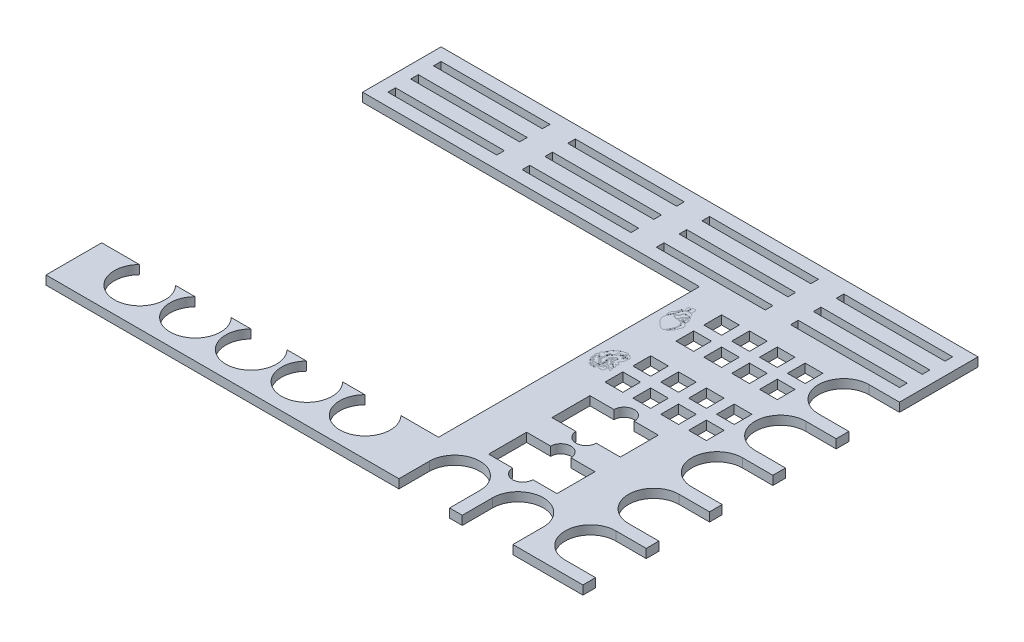
from build123d import *

# Parameters (mm, degrees)
SKETCH_1_W          = 43
SKETCH_1_H          = 3
SKETCH_1_W_2        = 7
SKETCH_1_H_2        = 7
EXTRUDE_1_DEPTH     = 3.5
CUT_EXTRUDE_START   = -0.01
CUT_EXTRUDE_1_DEPTH = 0.01


# Read off the part's stored shape, not the designer's step: Вырез-Вытянуть1
with BuildPart() as part:
    # Эскиз1 → Бобышка-Вытянуть1 (new body)
    with BuildSketch(Plane(origin=(0, 0, 0), x_dir=(1, 0, 0), z_dir=(0, 1, 0))):
        with BuildLine():
            Line((-106, 78), (106, 78))
            Line((106, 78), (106, 47))
            Line((106, 47), (94, 47))
            ThreePointArc((94, 47), (84, 37), (94, 27))
            Line((94, 27), (106, 27))
            Line((106, 27), (106, 22))
            Line((106, 22), (94, 22))
            ThreePointArc((94, 22), (84, 12), (94, 2))
            Line((94, 2), (106, 2))
            Line((106, 2), (106, -3))
            Line((106, -3), (94, -3))
            ThreePointArc((94, -3), (84, -13), (94, -23))
            Line((94, -23), (106, -23))
            Line((106, -23), (106, -28))
            Line((106, -28), (94, -28))
            ThreePointArc((94, -28), (84, -38), (94, -48))
            Line((94, -48), (106, -48))
            Line((106, -48), (106, -53))
            Line((106, -53), (94, -53))
            ThreePointArc((94, -53), (84, -63), (94, -73))
            Line((94, -73), (106, -73))
            Line((106, -73), (106, -78))
            Line((106, -78), (78.35327994, -78))
            Line((78.35327994, -78), (78.35327994, -66))
            ThreePointArc((78.35327994, -66), (68.35327994, -56), (58.35327994, -66))
            Line((58.35327994, -66), (58.35327994, -78))
            Line((58.35327994, -78), (53.35327994, -78))
            Line((53.35327994, -78), (53.35327994, -66))
            ThreePointArc((53.35327994, -66), (43.35327994, -56), (33.35327994, -66))
            Line((33.35327994, -66), (33.35327994, -78))
            Line((33.35327994, -78), (-106, -78))
            Line((-106, -78), (-106, -56))
            Line((-106, -56), (-91.141428429, -56))
            ThreePointArc((-91.141428429, -56), (-84, -73), (-76.858571571, -56))
            Line((-76.858571571, -56), (-69.141428429, -56))
            ThreePointArc((-69.141428429, -56), (-62, -73), (-54.858571571, -56))
            Line((-54.858571571, -56), (-47.141428429, -56))
            ThreePointArc((-47.141428429, -56), (-40, -73), (-32.858571571, -56))
            Line((-32.858571571, -56), (-25.141428429, -56))
            ThreePointArc((-25.141428429, -56), (-18, -73), (-10.858571571, -56))
            Line((-10.858571571, -56), (-2.141428429, -56))
            ThreePointArc((-2.141428429, -56), (5, -73), (12.141428429, -56))
            Line((12.141428429, -56), (27, -56))
            Line((27, -56), (27, 47))
            Line((27, 47), (-106, 47))
            Line((-106, 47), (-106, 78))
        make_face()
        with Locations((-26.5, 71.5)):
            Rectangle(SKETCH_1_W, SKETCH_1_H, mode=Mode.SUBTRACT)
        with Locations((-79.5, 71.5)):
            Rectangle(SKETCH_1_W, SKETCH_1_H, mode=Mode.SUBTRACT)
        with Locations((26.5, 71.5)):
            Rectangle(SKETCH_1_W, SKETCH_1_H, mode=Mode.SUBTRACT)
        with Locations((79.5, 71.5)):
            Rectangle(SKETCH_1_W, SKETCH_1_H, mode=Mode.SUBTRACT)
        with Locations((-26.5, 62.5)):
            Rectangle(SKETCH_1_W, SKETCH_1_H, mode=Mode.SUBTRACT)
        with Locations((26.5, 62.5)):
            Rectangle(SKETCH_1_W, SKETCH_1_H, mode=Mode.SUBTRACT)
        with Locations((79.5, 62.5)):
            Rectangle(SKETCH_1_W, SKETCH_1_H, mode=Mode.SUBTRACT)
        with Locations((-26.5, 53.5)):
            Rectangle(SKETCH_1_W, SKETCH_1_H, mode=Mode.SUBTRACT)
        with Locations((26.5, 53.5)):
            Rectangle(SKETCH_1_W, SKETCH_1_H, mode=Mode.SUBTRACT)
        with Locations((79.5, 53.5)):
            Rectangle(SKETCH_1_W, SKETCH_1_H, mode=Mode.SUBTRACT)
        with Locations((-79.5, 62.5)):
            Rectangle(SKETCH_1_W, SKETCH_1_H, mode=Mode.SUBTRACT)
        with Locations((-79.5, 53.5)):
            Rectangle(SKETCH_1_W, SKETCH_1_H, mode=Mode.SUBTRACT)
        with BuildLine():
            Line((60.157282311, -26.891683443), (69.657282311, -26.891683443))
            Line((69.657282311, -26.891683443), (69.657282311, -11.891683443))
            Line((69.657282311, -11.891683443), (60.157282311, -11.891683443))
            ThreePointArc((60.157282311, -11.891683443), (56.157282311, -7.891683443), (52.157282311, -11.891683443))
            Line((52.157282311, -11.891683443), (42.657282311, -11.891683443))
            Line((42.657282311, -11.891683443), (42.657282311, -26.891683443))
            Line((42.657282311, -26.891683443), (52.157282311, -26.891683443))
            ThreePointArc((52.157282311, -26.891683443), (56.157282311, -30.891683443), (60.157282311, -26.891683443))
        make_face(mode=Mode.SUBTRACT)
        with Locations((55.508285054, -0.759055808)):
            Rectangle(SKETCH_1_W_2, SKETCH_1_H_2, mode=Mode.SUBTRACT)
        with Locations((44.508285054, -0.759055808)):
            Rectangle(SKETCH_1_W_2, SKETCH_1_H_2, mode=Mode.SUBTRACT)
        with Locations((66.508285054, -0.759055808)):
            Rectangle(SKETCH_1_W_2, SKETCH_1_H_2, mode=Mode.SUBTRACT)
        with Locations((77.508285054, -0.759055808)):
            Rectangle(SKETCH_1_W_2, SKETCH_1_H_2, mode=Mode.SUBTRACT)
        with Locations((55.508285054, 10.240944192)):
            Rectangle(SKETCH_1_W_2, SKETCH_1_H_2, mode=Mode.SUBTRACT)
        with Locations((66.508285054, 10.240944192)):
            Rectangle(SKETCH_1_W_2, SKETCH_1_H_2, mode=Mode.SUBTRACT)
        with Locations((77.508285054, 10.240944192)):
            Rectangle(SKETCH_1_W_2, SKETCH_1_H_2, mode=Mode.SUBTRACT)
        with Locations((44.508285054, 10.240944192)):
            Rectangle(SKETCH_1_W_2, SKETCH_1_H_2, mode=Mode.SUBTRACT)
        with Locations((55.508285054, 27.240944192)):
            Rectangle(SKETCH_1_W_2, SKETCH_1_H_2, mode=Mode.SUBTRACT)
        with Locations((44.508285054, 27.240944192)):
            Rectangle(SKETCH_1_W_2, SKETCH_1_H_2, mode=Mode.SUBTRACT)
        with Locations((66.508285054, 27.240944192)):
            Rectangle(SKETCH_1_W_2, SKETCH_1_H_2, mode=Mode.SUBTRACT)
        with Locations((77.508285054, 27.240944192)):
            Rectangle(SKETCH_1_W_2, SKETCH_1_H_2, mode=Mode.SUBTRACT)
        with Locations((55.508285054, 38.240944192)):
            Rectangle(SKETCH_1_W_2, SKETCH_1_H_2, mode=Mode.SUBTRACT)
        with Locations((66.508285054, 38.240944192)):
            Rectangle(SKETCH_1_W_2, SKETCH_1_H_2, mode=Mode.SUBTRACT)
        with Locations((77.508285054, 38.240944192)):
            Rectangle(SKETCH_1_W_2, SKETCH_1_H_2, mode=Mode.SUBTRACT)
        with Locations((44.508285054, 38.240944192)):
            Rectangle(SKETCH_1_W_2, SKETCH_1_H_2, mode=Mode.SUBTRACT)
        with BuildLine():
            Line((60.157282311, -36.891683443), (69.657282311, -36.891683443))
            Line((69.657282311, -36.891683443), (69.657282311, -51.891683443))
            Line((69.657282311, -51.891683443), (60.157282311, -51.891683443))
            ThreePointArc((60.157282311, -51.891683443), (56.157282311, -55.891683443), (52.157282311, -51.891683443))
            Line((52.157282311, -51.891683443), (42.657282311, -51.891683443))
            Line((42.657282311, -51.891683443), (42.657282311, -36.891683443))
            Line((42.657282311, -36.891683443), (52.157282311, -36.891683443))
            ThreePointArc((52.157282311, -36.891683443), (56.157282311, -32.891683443), (60.157282311, -36.891683443))
        make_face(mode=Mode.SUBTRACT)
    extrude(amount=EXTRUDE_1_DEPTH)

    # Вырез-Вытянуть1 outline → Вырез-Вытянуть1 (cut)
    # profile 1 of 13: a face of its own
    with BuildSketch(Plane(origin=(0, 3.5, 0), x_dir=(1, 0, 0), z_dir=(0, 1, 0)).offset(CUT_EXTRUDE_START)):
        with BuildLine():
            add(Edge.make_bspline(
                [(37.832977201, 7.763436347), (37.914677943, 7.790986776), (37.901483831, 8.111154719), (37.979396005, 8.508934145), (37.745558638, 9.13651473), (37.172045165, 9.307799235), (36.914597154, 9.733838633), (36.454197836, 9.679216158), (36.38826052, 9.341730406), (36.266408211, 9.010402911), (36.566985616, 8.723711458), (36.470469, 8.34551423), (36.527236167, 7.951877991), (36.630416047, 7.676367478), (36.778652109, 7.393084703), (36.559656053, 7.331700916), (36.562836217, 7.51640169), (36.440727503, 7.639106553), (36.368027046, 7.861204922), (36.316991655, 8.125996091), (36.34010323, 8.475159808), (36.092331473, 8.811822858), (36.179691192, 9.227273069), (36.346051143, 9.581912444), (36.146529664, 9.821147035), (36.06241639, 10.127532137), (35.799692668, 10.019475797), (35.597408908, 10.099824068), (35.378820413, 9.990675661), (35.115064373, 9.966319968), (34.780382888, 9.941667453), (34.721012614, 9.521621938), (34.512438116, 9.684377566), (34.303007581, 9.791691711), (33.920850418, 9.749232874), (33.727340978, 9.436003806), (33.419232695, 9.257101273), (33.133138351, 9.105006569), (32.85126227, 9.025428053), (32.663565542, 8.875022744), (32.58608671, 8.619168376), (32.236423069, 8.590790349), (32.189352641, 8.309418297), (32.258155071, 8.003665917), (32.010591461, 8.10269937), (31.71588142, 8.014140252), (31.350270508, 7.725746948), (31.165184976, 7.229355433), (31.028807324, 6.966438466), (30.896720796, 6.599754894), (31.239129036, 6.71890562), (30.987903693, 6.388990282), (30.733910335, 6.4086924), (30.452477202, 6.077545214), (30.701936354, 5.836280429), (30.922243162, 5.85181202), (31.19492474, 5.685911997), (31.013469403, 5.515170267), (30.773173692, 5.462504607), (30.573313112, 5.670584735), (30.227593929, 5.718171132), (30.059519961, 5.347778115), (29.821467836, 5.090829313), (29.78541654, 4.738088915), (29.952717197, 4.492419252), (30.236644459, 4.416827534), (30.514473811, 4.284981509), (30.480464167, 3.96359377), (30.201281477, 4.029665399), (29.976447925, 4.130398166), (29.896212011, 4.434697829), (29.549986668, 4.328033512), (29.728240538, 4.05323911), (29.700561549, 3.751673921), (29.37583707, 3.630259512), (29.463653577, 3.361008299), (29.500587531, 3.091370689), (29.785568656, 3.155422712), (30.024144702, 3.233301074), (30.544016001, 3.180994742), (30.39271647, 2.855502384), (30.207148484, 3.118723249), (29.944029199, 3.073342607), (29.830009183, 2.914720413), (29.545518487, 2.805152738), (29.722151692, 2.656794481), (29.879784352, 2.816262734), (30.105429595, 2.777554357), (30.289116469, 2.684832798), (30.318400511, 2.381962758), (30.027179694, 2.594305604), (29.726233656, 2.485985992), (29.594091122, 2.197660783), (29.64031772, 1.808133771), (29.984974936, 1.927639157), (30.179945243, 1.969089542), (30.468235845, 2.004927187), (30.313493691, 2.291581888), (30.790979129, 2.259495131), (30.527637775, 2.020126024), (30.530368948, 1.807892679), (30.481338651, 1.557170441), (30.147652148, 1.455233382), (30.021179843, 1.728770804), (29.666779455, 1.659525271), (29.883977071, 1.359512284), (29.963560753, 1.113822), (30.092077, 0.862822596), (30.358436146, 0.767158475), (30.412145466, 1.054166616), (30.659158552, 1.174146925), (30.851482573, 1.378423875), (31.11742166, 1.539498902), (31.32908855, 1.339117802), (31.375589607, 1.108312552), (31.224822954, 0.951454439), (31.031640089, 0.894428065), (30.852595493, 0.944058676), (30.658603378, 0.977785669), (30.563725157, 0.698540566), (30.916563539, 0.769767865), (31.141512569, 0.586311242), (31.470010625, 0.648682568), (31.778911861, 0.5835134), (32.11984532, 0.686077531), (32.292368847, 0.817025346), (32.576115173, 0.913310702), (32.461765325, 0.686502779), (32.315741681, 0.567876334), (32.057844814, 0.321746902), (31.736146641, 0.492923975), (31.407989757, 0.446944053), (31.03108698, 0.327740981), (30.694321442, 0.738415348), (30.523945613, 0.47566347), (30.311012375, 0.400861753), (30.351570064, 0.098571572), (30.562827883, 0.007674876), (30.678761185, 0.086958306), (30.807104212, 0.285022359), (30.958414115, -0.107315409), (31.348829244, -0.017130902), (31.377842931, -0.378429405), (31.629652399, -0.685809733), (31.805549956, -0.323413876), (32.048661791, -0.664195718), (32.365239481, -0.747778088), (32.22895774, -1.130032528), (32.012536157, -0.842226182), (31.773376346, -0.708222863), (31.541387816, -1.011030549), (31.384973333, -0.695613483), (31.181652041, -0.741539145), (31.296446857, -0.969660348), (31.537419155, -0.95092917), (31.821969734, -1.043780517), (32.074363663, -1.185310568), (32.397311627, -1.40006263), (32.822220786, -1.258011547), (33.192303588, -0.954582395), (33.19735465, -0.408578221), (32.965962867, -0.049098829), (32.985843317, 0.325595297), (33.161247705, 0.564282624), (33.105307476, 0.915849981), (32.93376646, 1.215291377), (32.666379992, 1.264516877), (32.601406029, 1.488832029), (32.843064887, 1.596714046), (33.033646254, 1.242304964), (33.351010556, 1.444382781), (33.755015001, 1.446899685), (33.586102243, 1.825635966), (33.284416072, 1.778768145), (33.022486127, 1.724603879), (32.846803536, 1.878512361), (32.685587683, 2.063835784), (32.463820309, 1.982925336), (32.279215402, 1.774131097), (32.2301873, 2.022990615), (32.055013734, 2.093110558), (31.934422329, 1.953986301), (31.754818192, 2.061447165), (31.786954412, 2.237593276), (31.823422872, 2.428168257), (31.665766387, 2.593058585), (31.847590702, 2.808032658), (31.495463607, 2.841393232), (31.338020041, 2.722387226), (31.119083963, 2.688977049), (30.901053554, 2.747031023), (30.98588444, 3.224205537), (31.206396673, 2.833541234), (31.3004401, 3.119826741), (31.551448417, 3.145890622), (31.765904607, 3.00126118), (32.047771816, 2.9573704), (32.285066972, 3.142883804), (32.136267699, 3.404655056), (31.821049295, 3.326855546), (31.50149075, 3.484205161), (31.144771152, 3.355443095), (30.82384602, 3.511560685), (30.552796428, 3.433476894), (30.298544939, 3.630864106), (30.51258912, 3.825719984), (30.729532447, 3.645037797), (31.006179678, 3.702852958), (31.301625498, 3.622850543), (31.677820231, 3.71449344), (31.877109422, 4.068972948), (31.984111872, 4.425633766), (31.925674691, 4.746688574), (31.731169446, 5.07988369), (31.984264698, 5.382106302), (32.09147655, 5.68982143), (32.330040986, 5.821117079), (32.321942437, 6.171330178), (32.011942368, 6.087511343), (31.901407761, 6.322412004), (32.109231267, 6.568580806), (32.465735416, 6.634103308), (32.796747282, 6.414075547), (33.043243552, 6.618710675), (33.254344755, 6.766186992), (33.382417747, 6.992223866), (33.545234042, 7.212099726), (33.605081388, 7.532276018), (33.521127843, 7.869561278), (33.606623961, 8.217454429), (33.823282202, 8.494444748), (34.207705387, 8.557707204), (34.334242115, 8.34631462), (34.470170039, 8.184798733), (34.636658131, 8.373778116), (34.767255473, 8.54685575), (34.956645745, 8.740436556), (35.205411842, 8.729273224), (35.324909722, 8.639308814), (35.518775071, 8.56874904), (35.522975909, 8.760132659), (35.62583628, 8.884760752), (35.641635484, 9.107200734), (35.68632012, 9.293374951), (35.846923705, 9.556468753), (35.998565853, 9.352417895), (35.938789984, 9.188806293), (35.832693438, 9.015919367), (35.816095691, 8.81475707), (35.806700768, 8.556509763), (36.108028316, 8.370406405), (36.093360052, 8.022168813), (36.239669655, 7.684206105), (36.38253244, 7.338570422), (36.46392818, 7.035361901), (36.466339155, 6.781088577), (36.28314099, 6.762710575), (36.259957775, 6.943411675), (36.214412679, 7.121010557), (36.086196222, 7.323426736), (36.028933296, 7.583981918), (35.899086394, 7.820519003), (35.807700642, 8.053627715), (35.761185224, 8.238925934), (35.605063392, 8.402911749), (35.47032165, 8.216403513), (35.309695074, 8.049165757), (35.239233059, 7.800681964), (35.072502957, 7.557270186), (34.851711351, 7.633359881), (34.971430204, 7.811930666), (35.080412872, 7.923373001), (34.979895307, 8.103835649), (34.821715116, 7.887440589), (34.776943046, 7.722515684), (34.566001243, 7.562825717), (34.350695228, 7.67035676), (34.107892154, 7.636194837), (34.05859968, 7.43717264), (34.221389216, 7.32793201), (34.058824129, 7.039884855), (33.710665479, 6.992549804), (33.484199873, 6.67656291), (33.315539443, 6.378631018), (33.091150137, 6.148406432), (32.819978079, 6.151202069), (32.602560234, 6.144826552), (32.557640672, 5.92470001), (32.682642656, 5.791304427), (32.553413834, 5.607781658), (32.390476633, 5.473290872), (32.222545266, 5.312937585), (32.055267329, 5.144020167), (32.167598484, 4.963707501), (32.367185856, 5.008192252), (32.545024025, 5.143037609), (32.718477857, 4.994958601), (32.715022267, 4.778688808), (32.485280304, 4.761599664), (32.288658768, 4.548343476), (32.443267875, 4.319040744), (32.508966445, 4.078540666), (32.334478986, 3.944502294), (32.184291838, 3.849212021), (31.98568469, 3.722951741), (32.060922517, 3.445327083), (32.361292729, 3.55187298), (32.407715917, 3.342760789), (32.491762524, 3.103644933), (32.292909728, 2.822464554), (31.951870455, 2.668633179), (32.06946879, 2.433464089), (32.238103774, 2.343842771), (32.475447489, 2.230601893), (32.609398248, 2.442639382), (32.858298028, 2.401313145), (32.834842603, 2.143979672), (33.064984894, 2.02141442), (33.279630496, 2.079590212), (33.498678635, 1.993143076), (33.61134428, 1.852327541), (33.861781866, 1.861447877), (33.724579961, 2.011933823), (33.736595496, 2.19540262), (33.884666604, 2.354038329), (34.036598331, 2.502109981), (34.175294183, 2.694170788), (34.059173409, 2.959327011), (33.853850178, 2.960457365), (33.75226823, 3.074136729), (33.681579058, 3.266194388), (33.477752157, 3.501746692), (33.487428092, 3.938104599), (33.431642202, 4.42559658), (33.588200623, 4.979579736), (33.862188936, 5.509015074), (34.268487267, 5.91666657), (34.662574613, 6.284232719), (35.116065299, 6.500542291), (35.519792967, 6.359637387), (35.75153693, 6.035969528), (35.757127866, 5.673496639), (35.684208675, 5.307097663), (35.503455386, 5.048663241), (35.186226794, 4.792722757), (34.915388843, 4.999401024), (34.566172917, 4.896078299), (34.69647856, 4.613380376), (34.826274742, 4.430649765), (34.904817657, 4.245369742), (35.111175202, 4.031533253), (35.122611689, 4.260595743), (35.214347142, 4.434563474), (35.392121404, 4.261109599), (35.517948796, 4.058414482), (35.665201826, 4.229979654), (35.587331881, 4.389436333), (35.539526821, 4.558404957), (35.707957868, 4.736068232), (35.784302537, 4.432752234), (35.89167796, 4.22438545), (36.144720781, 4.149477306), (36.189704094, 3.883695933), (35.917362254, 3.868132317), (35.827733812, 3.659462243), (35.661832292, 3.46282986), (35.844403983, 3.154938771), (36.124590661, 3.204626693), (36.232150558, 3.381264179), (36.207472005, 3.735011308), (36.473835398, 3.382380178), (36.770857815, 3.353209909), (37.089298101, 3.012890676), (37.354070056, 2.813161339), (37.475316041, 2.212532046), (37.141275708, 2.454823441), (37.184614615, 2.762427577), (36.894364544, 3.035630837), (36.620220332, 3.218281087), (36.315724291, 3.188327632), (36.113021615, 3.021114994), (36.263219928, 2.786319607), (35.945008684, 2.699051782), (35.799206049, 2.925370723), (35.560790678, 3.058550229), (35.453810694, 3.292489814), (35.411449478, 3.55096188), (35.570952469, 3.686808039), (35.676491799, 3.878734647), (35.477877944, 4.006200614), (35.284916494, 3.864547372), (34.979314257, 3.91191085), (34.652899077, 4.137221282), (34.524669641, 4.511901463), (34.273194052, 4.770049411), (34.349002569, 5.079500717), (34.625677492, 5.167139318), (34.925133213, 5.211960776), (35.233111729, 5.200456111), (35.5303147, 5.447945202), (35.481014054, 5.781099585), (35.412600579, 6.228717047), (34.895591626, 6.065039389), (34.573107807, 5.8694018), (34.267470129, 5.593567025), (33.992061131, 5.210204214), (33.886478152, 4.832124629), (33.476407138, 3.976851665), (33.809937362, 4.188879818), (33.828364598, 4.344958393), (34.054065967, 4.483405579), (34.080439507, 4.121520263), (34.267065558, 3.902479837), (34.306066281, 3.55726276), (34.526645105, 3.328151744), (34.79220994, 3.260047014), (34.906487934, 2.95302151), (34.821849217, 2.692314504), (34.927531568, 2.257370998), (35.28420908, 2.490789989), (35.612916945, 2.279201731), (36.019002487, 2.162837923), (36.421268826, 1.941165226), (36.70600685, 1.589772216), (36.926288271, 1.257968294), (37.260193094, 1.035268451), (37.568356062, 1.074545942), (37.752487176, 0.864480788), (37.598834097, 0.628134275), (37.890175014, 0.66874812), (38.13141791, 0.812940694), (38.109964384, 1.223764938), (37.925465281, 1.587503926), (37.562461694, 1.720945186), (37.198662415, 1.550869829), (36.99753467, 2.084702353), (37.453397678, 1.972663079), (37.836892611, 1.744968457), (37.833059587, 2.04127998), (37.630208497, 2.283879537), (37.936489877, 2.437386335), (37.997860819, 2.805409191), (37.661815449, 3.157792146), (37.467387815, 3.708904081), (37.019718012, 3.718052292), (36.982655798, 4.129632608), (37.267671119, 3.893434929), (37.521311813, 3.894109204), (37.879893418, 4.00774105), (37.826550391, 4.330272111), (37.774716764, 4.663550794), (37.411698496, 4.621144494), (37.218317703, 4.818684934), (37.125315024, 5.160156548), (36.886048037, 4.96394143), (36.543743739, 4.947121381), (36.711270196, 5.22728655), (36.948358747, 5.346823052), (36.855020823, 5.580033058), (36.791128356, 5.796620659), (37.010193959, 5.813995165), (37.23460548, 5.611421077), (37.407373547, 6.087069654), (37.659311192, 6.321874727), (37.691892059, 6.732417523), (37.704215489, 7.097338465), (37.753113051, 7.479885001), (37.653939223, 7.743132797), (37.49003128, 7.919336524), (37.631057962, 8.065609236), (37.729856618, 7.921517811), (37.697655394, 7.753473728), (37.809931862, 7.755665194), (37.832977201, 7.763436347)],
                knots=[0, 0, 0, 0, 0.002058169, 0.005590102, 0.010995844, 0.015476205, 0.019040196, 0.021824579, 0.023863239, 0.026635451, 0.029616063, 0.032126407, 0.03535648, 0.038706157, 0.040137005, 0.041106883, 0.042199008, 0.043395885, 0.045259669, 0.047567109, 0.0498464, 0.053370491, 0.056609118, 0.059654011, 0.061512841, 0.063883366, 0.065381387, 0.06711352, 0.06882602, 0.070811203, 0.073592272, 0.075919609, 0.076902084, 0.078725854, 0.081897342, 0.084669554, 0.087040079, 0.090266343, 0.092377596, 0.09393399, 0.095804361, 0.098154045, 0.100588546, 0.102158705, 0.10326759, 0.105330235, 0.109677572, 0.113713962, 0.117096474, 0.118458383, 0.120009185, 0.121138536, 0.124838263, 0.127185646, 0.128789301, 0.131566161, 0.133120989, 0.134129459, 0.136370561, 0.13839678, 0.140600372, 0.143353111, 0.146829811, 0.149028669, 0.151213264, 0.153179983, 0.156114478, 0.1572926, 0.159293981, 0.161087793, 0.163468674, 0.164959173, 0.167061117, 0.169271325, 0.171556368, 0.173407264, 0.17533476, 0.17672027, 0.17907156, 0.182867882, 0.183555287, 0.185858353, 0.187243863, 0.189334526, 0.191076933, 0.191785495, 0.193486737, 0.195256056, 0.196900809, 0.19828632, 0.199975562, 0.202489266, 0.205203958, 0.20731013, 0.209621355, 0.21160163, 0.213195219, 0.214504067, 0.21654424, 0.218393013, 0.21977805, 0.221896529, 0.223851071, 0.226187028, 0.227798547, 0.22963544, 0.232514509, 0.234795341, 0.236191203, 0.237642026, 0.24022803, 0.242416806, 0.244596657, 0.246435697, 0.248366813, 0.249497796, 0.251281285, 0.25282634, 0.254034223, 0.255391644, 0.257304436, 0.259738098, 0.262362722, 0.264601495, 0.267311005, 0.270054879, 0.271098529, 0.272074291, 0.274133075, 0.276621926, 0.279223206, 0.281709782, 0.284446312, 0.288260207, 0.289489251, 0.290907837, 0.29319524, 0.29466307, 0.295442606, 0.296453723, 0.299173843, 0.300878358, 0.304381714, 0.3060824, 0.307855168, 0.31030755, 0.31305296, 0.314475581, 0.316911958, 0.318609574, 0.320484583, 0.323203264, 0.323575053, 0.324802838, 0.326950778, 0.329181511, 0.331786036, 0.333910167, 0.338036982, 0.341215599, 0.344748607, 0.349757548, 0.351038355, 0.353418965, 0.356391959, 0.358956626, 0.361067826, 0.362260046, 0.36324238, 0.366062765, 0.368767018, 0.371223649, 0.372987568, 0.375692814, 0.377652234, 0.378969999, 0.381047218, 0.382792728, 0.384208426, 0.385788718, 0.386747532, 0.388158245, 0.38924775, 0.390614069, 0.391980389, 0.393782492, 0.395040078, 0.396508294, 0.399361993, 0.400318969, 0.401699395, 0.404050998, 0.405701075, 0.407214186, 0.408624899, 0.411160295, 0.413181653, 0.415196029, 0.416602991, 0.418811704, 0.421885278, 0.42474391, 0.427119358, 0.429800599, 0.431353914, 0.432696832, 0.434612623, 0.436989553, 0.439080294, 0.441844333, 0.445418116, 0.448109845, 0.450578369, 0.453074563, 0.456416045, 0.458712787, 0.460729679, 0.462444859, 0.464743808, 0.465858561, 0.467617539, 0.471377501, 0.473606874, 0.475961354, 0.477982883, 0.479857834, 0.482002465, 0.484464395, 0.487275162, 0.490155969, 0.492617899, 0.495433224, 0.497551057, 0.498268827, 0.499821304, 0.501798109, 0.504274942, 0.505529994, 0.507250411, 0.508245939, 0.509160441, 0.510736399, 0.512234417, 0.514107833, 0.51595988, 0.517122929, 0.518535567, 0.519901885, 0.521919852, 0.523288074, 0.525712074, 0.529126098, 0.530776622, 0.534506043, 0.537822899, 0.538743079, 0.539703999, 0.540864487, 0.542307093, 0.544307841, 0.546378043, 0.548599427, 0.550706675, 0.552236395, 0.55334003, 0.555009971, 0.556249814, 0.559159256, 0.561214079, 0.56207017, 0.563382318, 0.564944524, 0.565618224, 0.567165595, 0.568935469, 0.57044856, 0.572512463, 0.574333516, 0.575253695, 0.576647776, 0.577969811, 0.581675747, 0.584482566, 0.5866661, 0.590126284, 0.591023092, 0.593230911, 0.594192284, 0.595695159, 0.596802753, 0.598874357, 0.600852278, 0.602606167, 0.603551784, 0.604991976, 0.606794122, 0.608322228, 0.609281247, 0.611223091, 0.612708861, 0.615348385, 0.616903344, 0.617918518, 0.620108532, 0.621514158, 0.622894614, 0.625158561, 0.626369591, 0.627226808, 0.631251185, 0.633114591, 0.634650073, 0.636109618, 0.637969229, 0.6398258, 0.640894833, 0.642884008, 0.644521446, 0.646213196, 0.648056403, 0.649610177, 0.650784976, 0.651760195, 0.652976586, 0.655058778, 0.656591041, 0.658151288, 0.660372941, 0.661709614, 0.662606281, 0.663787744, 0.666592301, 0.669629971, 0.673738996, 0.678291568, 0.683014081, 0.687798871, 0.691820105, 0.695964834, 0.698892369, 0.701159431, 0.705024334, 0.707105486, 0.709917616, 0.712646308, 0.715269417, 0.717229478, 0.718944568, 0.721182826, 0.722743581, 0.724335212, 0.725650626, 0.72663169, 0.728318968, 0.730056765, 0.730829746, 0.732616634, 0.733817062, 0.73492007, 0.736667951, 0.738674361, 0.741078031, 0.741916446, 0.744110172, 0.74545204, 0.747196049, 0.74983611, 0.751409803, 0.752997182, 0.754792372, 0.756790005, 0.759441307, 0.762543704, 0.766703409, 0.769463624, 0.770588476, 0.774142529, 0.776094296, 0.779676007, 0.781514354, 0.783245917, 0.78466514, 0.786326583, 0.788406435, 0.79058346, 0.792629896, 0.794400826, 0.796189983, 0.797505397, 0.798659902, 0.800488665, 0.802574358, 0.805603115, 0.809428644, 0.81182781, 0.8135429, 0.815938119, 0.818041239, 0.82093113, 0.822995324, 0.826222867, 0.82859084, 0.831990142, 0.835717954, 0.838404206, 0.841680386, 0.846200178, 0.851395907, 0.852145809, 0.854208037, 0.855091975, 0.857140391, 0.859722467, 0.862748098, 0.864697093, 0.866980198, 0.868796351, 0.871606077, 0.874077953, 0.876321492, 0.879038813, 0.882694792, 0.886547032, 0.889653515, 0.893343291, 0.896029489, 0.898679669, 0.900169083, 0.901625878, 0.902935609, 0.904974307, 0.908469012, 0.911033184, 0.914599344, 0.916398075, 0.919406331, 0.921650734, 0.92516452, 0.925522481, 0.928292778, 0.930710671, 0.93153573, 0.936860961, 0.941210223, 0.944096195, 0.945620159, 0.947465047, 0.949629526, 0.952522414, 0.954222728, 0.956819661, 0.959207558, 0.961170232, 0.963380477, 0.965276741, 0.967247558, 0.968728885, 0.970944558, 0.972945621, 0.97411243, 0.975201126, 0.976929469, 0.980083344, 0.983395021, 0.985708741, 0.98932601, 0.992347947, 0.994529416, 0.996151811, 0.997039082, 0.997822353, 0.999419452, 1, 1, 1, 1], degree=3))
        make_face()
        with BuildLine():
            add(Edge.make_bspline(
                [(31.731966154, 0.08796753), (31.680961754, 0.077141818), (31.550488343, -0.109303461), (31.804422575, -0.276362582), (32.049958273, -0.299998888), (32.340531556, -0.341545649), (32.62662257, -0.614034417), (32.823281266, -0.262547246), (32.526570797, -0.152345878), (32.277456365, -0.017712929), (31.953113763, -0.293114126), (31.82019397, 0.106693933), (31.731966154, 0.08796753)],
                knots=[0, 0, 0, 0, 0.07186578, 0.160511158, 0.259957502, 0.355406992, 0.496087521, 0.560337325, 0.682330762, 0.749820363, 0.875686006, 1, 1, 1, 1], degree=3))
        make_face(mode=Mode.SUBTRACT)
        with BuildLine():
            add(Edge.make_bspline(
                [(37.170933169, 7.575471781), (37.194724921, 7.597147053), (37.162702372, 7.838600265), (37.117814485, 8.04643662), (37.267500615, 8.224006882), (37.189649301, 8.426038503), (37.546657804, 8.413249441), (37.16613155, 8.734759523), (37.107345243, 8.341838264), (36.937231944, 8.119180973), (36.87509294, 7.809523947), (37.135893121, 7.543548845), (37.170933169, 7.575471781)],
                knots=[0, 0, 0, 0, 0.076968127, 0.208353848, 0.283447256, 0.333438955, 0.412862051, 0.509684507, 0.623431099, 0.736757477, 0.886642778, 1, 1, 1, 1], degree=3))
        make_face(mode=Mode.SUBTRACT)
    # profile 2 of 13: a face of its own
    with BuildSketch(Plane(origin=(0, 3.5, 0), x_dir=(1, 0, 0), z_dir=(0, 1, 0)).offset(CUT_EXTRUDE_START)):
        with BuildLine():
            add(Edge.make_bspline(
                [(35.73348503, 31.331875286), (35.822007858, 31.309324904), (35.960941558, 31.716902333), (36.110389123, 32.102231892), (36.414884853, 31.901602713), (36.811724318, 31.982905114), (36.963320258, 32.509583834), (36.689534831, 32.636178294), (36.410759665, 32.629884995), (36.620020165, 32.855990077), (36.895584303, 32.808396776), (36.853129202, 33.143536536), (36.7176215, 33.371162312), (36.431031743, 33.305401217), (36.101859864, 33.402687018), (35.919323536, 33.153476533), (35.610646105, 33.077820697), (35.869302041, 32.80557101), (35.806043798, 32.509976222), (35.7411694, 32.16652011), (35.523525237, 31.834786889), (35.653003707, 31.352377167), (35.73348503, 31.331875286)],
                knots=[0, 0, 0, 0, 0.091498589, 0.131201499, 0.174730975, 0.229508299, 0.317416272, 0.344504904, 0.378092393, 0.405236471, 0.446062498, 0.489237745, 0.529707337, 0.562165733, 0.620377584, 0.68173266, 0.700757016, 0.751296602, 0.792261313, 0.853585673, 0.916813238, 1, 1, 1, 1], degree=3))
        make_face()
    # profile 3 of 13: a face of its own
    with BuildSketch(Plane(origin=(0, 3.5, 0), x_dir=(1, 0, 0), z_dir=(0, 1, 0)).offset(CUT_EXTRUDE_START)):
        with BuildLine():
            add(Edge.make_bspline(
                [(34.548543733, 31.54110955), (34.736800663, 31.529556994), (35.188365509, 31.657551386), (34.74411583, 32.11321363), (34.770516337, 32.468581755), (34.892594072, 32.713428401), (35.17943944, 32.734798634), (35.11721252, 32.45174426), (35.171371975, 32.159487103), (35.077718415, 31.785098142), (35.223282292, 31.545566858), (35.435947404, 31.442101683), (35.558001016, 31.769412428), (35.266329614, 32.055596229), (35.675012729, 32.38637704), (35.595272299, 32.785671128), (35.544206166, 33.151226859), (35.270519893, 33.320469965), (34.937166043, 33.544182845), (34.451445692, 33.118323168), (34.071227784, 32.650105143), (34.055756836, 32.0864821), (34.166664141, 31.661664941), (34.396123049, 31.550462983), (34.548543733, 31.54110955)],
                knots=[0, 0, 0, 0, 0.060758404, 0.118323278, 0.17101214, 0.190297341, 0.220268822, 0.236015841, 0.281611972, 0.341358253, 0.367103619, 0.384874325, 0.415377754, 0.457141554, 0.513199823, 0.560852411, 0.605245605, 0.644268182, 0.677779688, 0.745366825, 0.843992463, 0.908843498, 0.950807455, 1, 1, 1, 1], degree=3))
        make_face()
    # profile 4 of 13: a face of its own
    with BuildSketch(Plane(origin=(0, 3.5, 0), x_dir=(1, 0, 0), z_dir=(0, 1, 0)).offset(CUT_EXTRUDE_START)):
        with BuildLine():
            add(Edge.make_bspline(
                [(35.142116047, 25.413721219), (35.216684395, 25.3723304), (36.461721794, 26.561883327), (37.053088929, 27.588591797), (37.471869022, 28.889372333), (37.946290092, 29.796148855), (37.693397483, 30.496566302), (37.438035602, 31.006734572), (37.022465629, 31.298185114), (36.790681904, 31.77725544), (36.222732693, 31.776551278), (35.979061386, 31.386276736), (35.964629921, 30.93163579), (36.506587929, 30.432676827), (36.654631674, 29.497691126), (36.447252383, 28.107776382), (36.108385974, 27.042248651), (35.062152154, 25.458106955), (35.142116047, 25.413721219)],
                knots=[0, 0, 0, 0, 0.090415468, 0.210921603, 0.29618235, 0.360703134, 0.407546035, 0.439914208, 0.475233999, 0.509049139, 0.538540732, 0.570319335, 0.592627306, 0.625725843, 0.70982279, 0.773582732, 0.903042337, 1, 1, 1, 1], degree=3))
        make_face()
    # profile 5 of 13: a face of its own
    with BuildSketch(Plane(origin=(0, 3.5, 0), x_dir=(1, 0, 0), z_dir=(0, 1, 0)).offset(CUT_EXTRUDE_START)):
        with BuildLine():
            add(Edge.make_bspline(
                [(30.98428007, 32.345050832), (30.743060471, 31.817500046), (30.243524172, 30.939674727), (29.840074426, 28.9760483), (31.038881, 27.234578116), (32.4801819, 25.943104763), (33.576825146, 25.241387653), (34.677833274, 25.192063584), (34.947151543, 25.877954575), (35.427792501, 26.654502382), (36.122779093, 27.70200471), (36.402180628, 29.325978674), (36.064231823, 30.614159366), (35.39454411, 31.227146034), (34.906666217, 31.219149191), (34.413524403, 31.305694759), (34.004013648, 31.584563714), (33.44095096, 31.529284915), (32.874648468, 31.486343293), (32.294870957, 31.708692113), (31.87316418, 32.093645143), (31.846497683, 32.602610634), (31.460467324, 32.761428023), (31.124096113, 32.659686819), (31.030497398, 32.446128801), (30.98428007, 32.345050832)],
                knots=[0, 0, 0, 0, 0.079117596, 0.145993552, 0.267864619, 0.349032823, 0.421450152, 0.449804784, 0.486653994, 0.510441945, 0.581822289, 0.659259561, 0.736801464, 0.757349615, 0.780340718, 0.802281806, 0.827737968, 0.846225793, 0.879678872, 0.907027726, 0.931302088, 0.956353008, 0.96856418, 0.984841183, 1, 1, 1, 1], degree=3))
        make_face()
    # profile 6 of 13: a face of its own
    with BuildSketch(Plane(origin=(0, 3.5, 0), x_dir=(1, 0, 0), z_dir=(0, 1, 0)).offset(CUT_EXTRUDE_START)):
        with BuildLine():
            add(Edge.make_bspline(
                [(33.254350509, -1.397449853), (33.316057379, -1.484809307), (33.690906142, -1.483932079), (33.813135576, -1.145605249), (34.194852117, -0.819419483), (33.771406865, -0.494701962), (34.045160601, -0.011680418), (34.116614086, -0.430429168), (34.434915405, -0.275766854), (34.768755201, -0.300677957), (34.813261562, -0.615616915), (35.128401181, -0.882509905), (35.444654521, -0.434066485), (35.773114616, -0.922272772), (36.015694479, -0.457886193), (36.313240651, -0.898186393), (36.489619002, -0.61096512), (36.775035748, -0.491186288), (36.404769875, -0.259239461), (36.591324929, 0.046842245), (36.716548709, 0.330713279), (36.77205874, 0.698391559), (36.419788984, 0.83037664), (36.175014047, 1.051573036), (35.84156083, 1.136316056), (35.550721131, 0.964794759), (35.576744318, 0.69762097), (35.718217034, 0.368184317), (35.271195545, 0.35152511), (35.505838825, 0.731500001), (34.944678411, 0.858540129), (35.073991101, 0.370498463), (34.739556567, 0.286485239), (34.54980192, 0.065062813), (34.206885181, 0.121373717), (33.967296357, 0.140586244), (33.635500368, 0.051459756), (33.704980983, 0.412455376), (33.728983561, 0.682928842), (33.58328642, 0.948187106), (33.337972815, 1.345420616), (33.405042514, 0.842390247), (33.377811865, 0.547506012), (33.40198335, 0.116200363), (33.337867466, -0.320594053), (33.559838495, -0.714374051), (33.376753002, -1.040267712), (33.19509908, -1.313566608), (33.254350509, -1.397449853)],
                knots=[0, 0, 0, 0, 0.029256534, 0.044782679, 0.074682023, 0.11099153, 0.128180423, 0.14179097, 0.165069214, 0.182503649, 0.203633296, 0.223042536, 0.251217883, 0.276505958, 0.295362217, 0.319233892, 0.338643132, 0.351373251, 0.367795456, 0.39705601, 0.409148663, 0.436429348, 0.458320527, 0.477678747, 0.506212889, 0.524027495, 0.535663702, 0.560744402, 0.574408941, 0.593372742, 0.614697705, 0.640938938, 0.656896819, 0.677435877, 0.69786472, 0.720938441, 0.736359259, 0.747506237, 0.780903822, 0.793903817, 0.817093818, 0.835374862, 0.861235851, 0.891555631, 0.92035161, 0.953456898, 0.971907642, 1, 1, 1, 1], degree=3))
        make_face()
    # profile 7 of 13: a face of its own
    with BuildSketch(Plane(origin=(0, 3.5, 0), x_dir=(1, 0, 0), z_dir=(0, 1, 0)).offset(CUT_EXTRUDE_START)):
        with BuildLine():
            add(Edge.make_bspline(
                [(33.892272983, 3.979992795), (33.863565042, 3.973063116), (33.816695822, 3.623533396), (33.956511702, 3.387419965), (33.969485428, 2.885295003), (34.311309188, 2.967463873), (34.215405075, 2.615477561), (34.155747349, 2.387553953), (34.022373608, 2.212829514), (34.020786332, 1.914870715), (34.127616629, 2.216102979), (34.389809483, 2.418420711), (34.362365646, 2.082689455), (34.216978143, 1.901065942), (34.143924831, 1.627196199), (34.02061846, 1.379156947), (33.805619552, 1.069341149), (34.07963085, 0.855017044), (33.99021665, 0.423181457), (34.221052099, 0.819245109), (34.544671998, 0.881301126), (34.382516197, 1.198245134), (34.152278405, 1.381058244), (34.458305138, 1.641328785), (34.452091976, 1.169860494), (34.723851599, 1.065239697), (34.962251467, 1.014173543), (35.158320508, 1.261451745), (34.896828152, 1.39269663), (35.104464375, 1.716321643), (35.258104285, 1.411062405), (35.332822926, 1.219243575), (35.713328408, 1.208314851), (35.440335503, 1.46140959), (35.465444282, 1.612164249), (35.44411131, 1.838347116), (35.563709451, 1.449898566), (35.761047012, 1.442822395), (35.95472172, 1.316192014), (36.200018106, 1.213898366), (36.511254561, 1.253733887), (36.724121354, 1.015368652), (36.976797783, 0.949243758), (37.085585714, 0.561087801), (37.368911222, 0.879470476), (37.079706297, 0.990667892), (36.982834179, 1.253361075), (36.683042149, 1.349126424), (36.547854344, 1.682991697), (36.125164802, 1.681222193), (35.859321966, 2.044504825), (35.403102986, 1.983413832), (35.041771025, 1.927177785), (34.714808562, 2.161663243), (34.712631218, 2.472868446), (34.710376509, 2.748406123), (34.721367221, 3.034720741), (34.459897511, 3.250848412), (34.058578106, 3.312158161), (34.018160327, 3.637602371), (33.922481568, 3.987284707), (33.892272983, 3.979992795)],
                knots=[0, 0, 0, 0, 0.016717814, 0.03991427, 0.069343474, 0.076049633, 0.091959157, 0.11274808, 0.127371654, 0.137001103, 0.148274184, 0.166081093, 0.176368807, 0.194741377, 0.213729899, 0.227075369, 0.249238007, 0.271655871, 0.284565844, 0.302582809, 0.320456732, 0.33830971, 0.354492445, 0.364913892, 0.388526321, 0.402112176, 0.418592698, 0.431328382, 0.444118813, 0.458004225, 0.473861278, 0.487321056, 0.499722569, 0.518820223, 0.523930292, 0.531769539, 0.546712662, 0.561547463, 0.569995895, 0.589307567, 0.611416858, 0.622902228, 0.646162788, 0.660345002, 0.675420902, 0.689460578, 0.703710393, 0.726959434, 0.741931793, 0.765132975, 0.79541939, 0.816020042, 0.846515872, 0.862184489, 0.884753357, 0.899813465, 0.915966268, 0.935203351, 0.958192373, 0.982408299, 1, 1, 1, 1], degree=3))
        make_face()
    # profile 8 of 13: a face of its own
    with BuildSketch(Plane(origin=(0, 3.5, 0), x_dir=(1, 0, 0), z_dir=(0, 1, 0)).offset(CUT_EXTRUDE_START)):
        with BuildLine():
            add(Edge.make_bspline(
                [(30.06383559, 30.892898183), (30.205093583, 30.892960199), (30.462760539, 31.769785612), (30.671446927, 32.385483926), (30.986493749, 32.752389437), (31.194349343, 33.236474667), (31.254319559, 33.718516105), (31.381771874, 34.194315417), (31.490437936, 34.546397951), (31.5264213, 34.923089803), (31.873033094, 34.933813722), (31.735661006, 35.249663409), (32.021191044, 35.436967323), (31.810499466, 35.644349548), (31.599964435, 35.764750275), (31.274395875, 35.537272182), (31.140041262, 35.050492621), (30.977677896, 34.403805336), (30.792325966, 33.711784081), (30.042107054, 33.131152878), (29.721817439, 32.271149147), (29.923094263, 30.892836394), (30.06383559, 30.892898183)],
                knots=[0, 0, 0, 0, 0.1070515, 0.145877194, 0.196050883, 0.235455841, 0.290764818, 0.330332138, 0.369878111, 0.399395029, 0.417326368, 0.439923768, 0.465471299, 0.485575291, 0.505138374, 0.529597762, 0.579603912, 0.642769461, 0.717220832, 0.769804242, 0.893340053, 1, 1, 1, 1], degree=3))
        make_face()
    # profile 9 of 13: a face of its own
    with BuildSketch(Plane(origin=(0, 3.5, 0), x_dir=(1, 0, 0), z_dir=(0, 1, 0)).offset(CUT_EXTRUDE_START)):
        with BuildLine():
            add(Edge.make_bspline(
                [(32.065432888, 36.581285653), (32.125462484, 36.457978309), (32.278380317, 36.285455347), (32.140035759, 35.881796238), (32.492478245, 35.978098699), (32.730096247, 36.199489235), (32.880938364, 36.67960585), (32.789862717, 37.184849135), (32.941011304, 37.638840696), (32.648172072, 37.978346469), (32.286883946, 37.789167588), (31.870138284, 37.628877769), (31.967456231, 37.10193632), (31.973224811, 36.770691111), (32.065432888, 36.581285653)],
                knots=[0, 0, 0, 0, 0.088905799, 0.139467211, 0.176366496, 0.256200867, 0.354657764, 0.465892872, 0.57712798, 0.622121214, 0.705955007, 0.795178909, 0.863436817, 1, 1, 1, 1], degree=3))
        make_face()
    # profile 10 of 13: a face of its own
    with BuildSketch(Plane(origin=(0, 3.5, 0), x_dir=(1, 0, 0), z_dir=(0, 1, 0)).offset(CUT_EXTRUDE_START)):
        with BuildLine():
            add(Edge.make_bspline(
                [(32.054774496, 32.672110392), (31.954828593, 32.528875542), (32.231006378, 32.007818705), (32.714571731, 31.690711608), (33.220860229, 31.667631673), (33.866162022, 31.848287618), (33.849503404, 32.688718061), (34.217894201, 33.212280988), (34.52629196, 33.525483049), (34.918508656, 33.619899928), (35.151320291, 34.175554296), (35.702938628, 33.993371317), (36.108616897, 33.723153865), (36.300414728, 34.038169411), (36.31126984, 34.463695403), (35.706439588, 34.480124918), (35.177258251, 34.565969017), (34.660424049, 34.736916808), (34.09747569, 34.700742937), (33.388329453, 34.687759535), (33.167249467, 33.915987024), (33.032768721, 33.270633338), (32.637959403, 32.808273315), (32.133446522, 32.784857143), (32.054774496, 32.672110392)],
                knots=[0, 0, 0, 0, 0.058730616, 0.099643467, 0.154246897, 0.182007468, 0.259133602, 0.32459265, 0.347911211, 0.368181072, 0.424630332, 0.463893573, 0.501428374, 0.523456971, 0.542751445, 0.6000088, 0.633381294, 0.689943955, 0.73241737, 0.780728123, 0.852632583, 0.903405717, 0.953770426, 1, 1, 1, 1], degree=3))
        make_face()
    # profile 11 of 13: a face of its own
    with BuildSketch(Plane(origin=(0, 3.5, 0), x_dir=(1, 0, 0), z_dir=(0, 1, 0)).offset(CUT_EXTRUDE_START)):
        with BuildLine():
            add(Edge.make_bspline(
                [(35.142116047, 33.606356054), (35.214201588, 33.52788266), (35.507835295, 33.674591644), (35.584990592, 33.242732508), (35.663654586, 33.509341765), (35.708425024, 33.777156816), (35.100136191, 34.045329639), (35.096207466, 33.656332819), (35.142116047, 33.606356054)],
                knots=[0, 0, 0, 0, 0.216143643, 0.337122559, 0.411274321, 0.553611588, 0.862346213, 1, 1, 1, 1], degree=3))
        make_face()
    # profile 12 of 13: a face of its own
    with BuildSketch(Plane(origin=(0, 3.5, 0), x_dir=(1, 0, 0), z_dir=(0, 1, 0)).offset(CUT_EXTRUDE_START)):
        with BuildLine():
            add(Edge.make_bspline(
                [(33.550696885, 38.314845724), (33.444346063, 38.297795496), (33.260746815, 38.242408592), (33.034036209, 38.019944262), (33.114290398, 37.63911171), (33.071136521, 37.271831392), (33.106037151, 36.825283998), (33.003677645, 36.551354367), (33.113290307, 36.202616057), (33.413657635, 36.515424163), (33.699060937, 36.459248093), (33.998118957, 36.398138177), (34.267571556, 36.244041536), (34.607259176, 36.387064965), (34.509758018, 36.769497541), (34.56025724, 37.130426882), (34.542834679, 37.493585187), (34.562402669, 37.828980907), (34.393912491, 38.200014565), (33.955066962, 38.334008502), (33.680230943, 38.335612702), (33.550696885, 38.314845724)],
                knots=[0, 0, 0, 0, 0.050425385, 0.088471213, 0.134099843, 0.21775233, 0.265282152, 0.339608968, 0.353887657, 0.414606114, 0.453121834, 0.492793286, 0.556267608, 0.592866886, 0.630890744, 0.714543231, 0.771579018, 0.798195718, 0.872185816, 0.93858247, 1, 1, 1, 1], degree=3))
        make_face()
    # profile 13 of 13: a face of its own
    with BuildSketch(Plane(origin=(0, 3.5, 0), x_dir=(1, 0, 0), z_dir=(0, 1, 0)).offset(CUT_EXTRUDE_START)):
        with BuildLine():
            add(Edge.make_bspline(
                [(31.487184846, 32.988105248), (31.599803001, 32.892481729), (32.209049652, 32.900769805), (32.863553299, 33.282138629), (32.957585829, 34.053781926), (33.172280393, 34.648615133), (33.710498692, 35.076735865), (34.295769411, 34.903047355), (34.75494927, 34.793800308), (35.135475928, 34.811678389), (35.344187176, 34.716150425), (35.621690294, 34.629188548), (35.59863456, 34.837334504), (35.457557209, 35.07617112), (35.478453856, 35.747312258), (34.461532478, 36.150518494), (33.404067144, 36.207727809), (32.399336877, 35.775989677), (31.842530643, 34.888639418), (31.698263271, 34.076679982), (31.296254436, 33.150223319), (31.487184846, 32.988105248)],
                knots=[0, 0, 0, 0, 0.047411747, 0.117198117, 0.173383579, 0.226707913, 0.271902707, 0.324785037, 0.364247035, 0.390975574, 0.412277197, 0.429289558, 0.438270409, 0.453054274, 0.501329025, 0.582204149, 0.677756183, 0.767673096, 0.833255153, 0.919619137, 1, 1, 1, 1], degree=3))
        make_face()
    extrude(amount=CUT_EXTRUDE_1_DEPTH, mode=Mode.SUBTRACT)


solid = part.part
